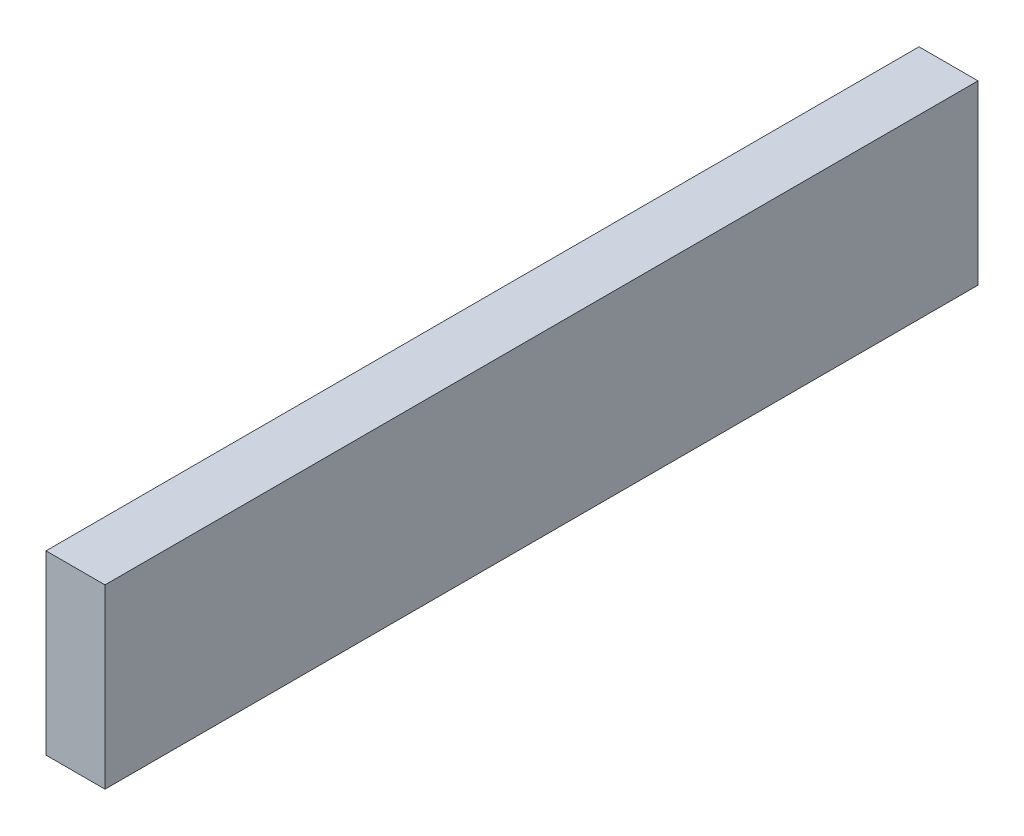
from build123d import *

# Parameters (mm, degrees)
SKETCH1_W            = 15
SKETCH1_H            = 20
BOSS_EXTRUDE1_DEPTH  = 230
SKETCH2_W            = 65
SKETCH2_H            = 40
BOSS_EXTRUDE6_DEPTH  = 5
SKETCH7_W            = 74
SKETCH7_H            = 15
BOSS_EXTRUDE7_DEPTH  = 5
SKETCH8_W            = 74
SKETCH8_H            = 15
BOSS_EXTRUDE8_DEPTH  = 5
SKETCH9_W            = 65
SKETCH9_H            = 40
BOSS_EXTRUDE11_DEPTH = 5
CUT_EXTRUDE1_DEPTH   = 240.635139326


with BuildPart() as part:
    # Sketch1 → Boss-Extrude1 (new body)
    with BuildSketch(Plane.XY):
        Rectangle(SKETCH1_W, SKETCH1_H)
    extrude(amount=BOSS_EXTRUDE1_DEPTH)

    # Sketch10 → Cut-Extrude1 (cut, through all)
    with BuildSketch(Plane.ZY.offset(7.5)):
        with BuildLine():
            Line((209.843145751, 2), (211.343145751, 2))
            ThreePointArc((211.343145751, 2), (223, 0), (211.343145751, -2))
            Line((211.343145751, -2), (209.843145751, -2))
            Line((209.843145751, -2), (209.843145751, 2))
        make_face()
    extrude(amount=-CUT_EXTRUDE1_DEPTH, mode=Mode.SUBTRACT)


with BuildPart() as body_2:
    # Sketch2 → Boss-Extrude6 (new body)
    with BuildSketch(Plane(origin=(0, 0, 0), x_dir=(-1, 0, 0), z_dir=(0, 0, -1))):
        with Locations((0, 30)):
            Rectangle(SKETCH2_W, SKETCH2_H)
    extrude(amount=-BOSS_EXTRUDE6_DEPTH)


with BuildPart() as body_3:
    # Sketch7 → Boss-Extrude7 (new body)
    with BuildSketch(Plane(origin=(32.5, 0, 0), x_dir=(0, 0, -1), z_dir=(1, 0, 0))):
        with Locations((-37, 30)):
            Rectangle(SKETCH7_W, SKETCH7_H)
    extrude(amount=BOSS_EXTRUDE7_DEPTH)


with BuildPart() as body_4:
    # Sketch8 → Boss-Extrude8 (new body)
    with BuildSketch(Plane.ZY.offset(32.5)):
        with Locations((37, 30)):
            Rectangle(SKETCH8_W, SKETCH8_H)
    extrude(amount=BOSS_EXTRUDE8_DEPTH)


with BuildPart() as body_5:
    # Sketch9 → Boss-Extrude11 (new body)
    with BuildSketch(Plane.XY.offset(74)):
        with Locations((0, 30)):
            Rectangle(SKETCH9_W, SKETCH9_H)
    extrude(amount=-BOSS_EXTRUDE11_DEPTH)


solid = body_3.part
